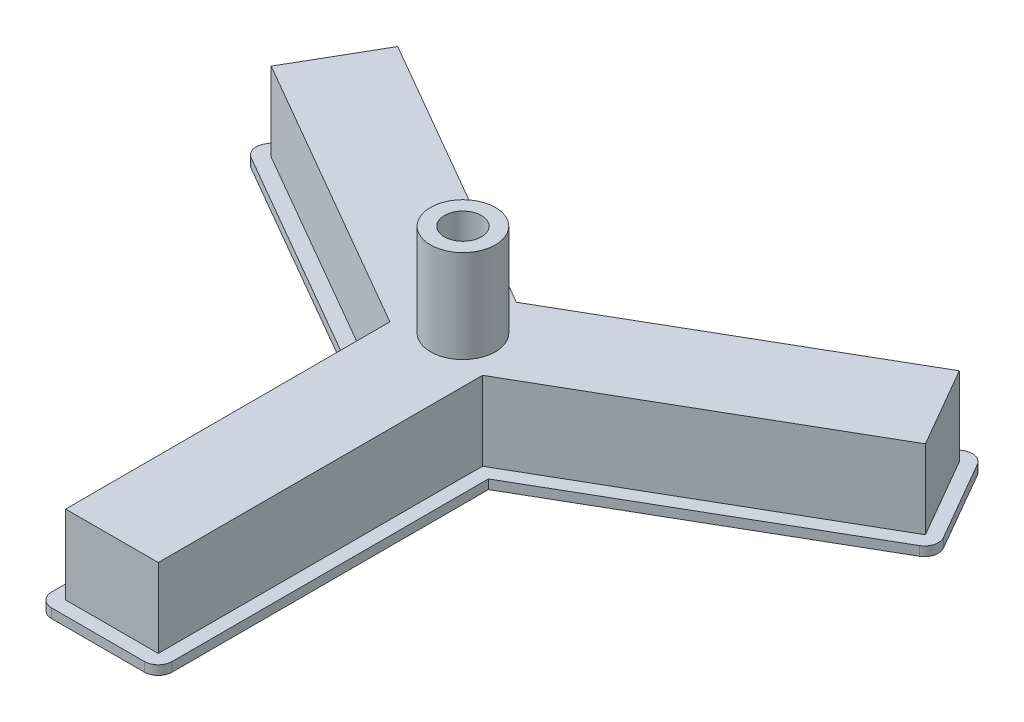
from build123d import *

# Parameters (mm, degrees)
EXTRUDE_1_DEPTH                  = 18
CUT_EXTRUDE_1_DEPTH              = 15
SKETCH_3_R                       = 4
EXTRUDE_5_DEPTH                  = 40
EXTRUDE_6_DEPTH                  = 5
EXTRUDE_7_DEPTH                  = 13.5
PATTERN_LINEAR_1_COUNT           = 8
PATTERN_LINEAR_1_PITCH           = 8.5
PATTERN_CIRCULAR_1_COUNT         = 3
PATTERN_CIRCULAR_1_COPY_1_DEPTH  = 13.5
PATTERN_CIRCULAR_1_COPY_2_DEPTH  = 13.5
PATTERN_CIRCULAR_1_COPY_3_DEPTH  = 13.5
PATTERN_CIRCULAR_1_COPY_4_DEPTH  = 13.5
PATTERN_CIRCULAR_1_COPY_5_DEPTH  = 13.5
PATTERN_CIRCULAR_1_COPY_6_DEPTH  = 13.5
PATTERN_CIRCULAR_1_COPY_7_DEPTH  = 13.5
PATTERN_CIRCULAR_1_COPY_8_DEPTH  = 13.5
PATTERN_CIRCULAR_1_COPY_9_DEPTH  = 13.5
PATTERN_CIRCULAR_1_COPY_10_DEPTH = 13.5
PATTERN_CIRCULAR_1_COPY_11_DEPTH = 13.5
PATTERN_CIRCULAR_1_COPY_12_DEPTH = 13.5
PATTERN_CIRCULAR_1_COPY_13_DEPTH = 13.5
PATTERN_CIRCULAR_1_COPY_14_DEPTH = 13.5
EXTRUDE_8_DEPTH                  = 18
EXTRUDE_9_DEPTH                  = 2
SKETCH_8_R                       = 7
SKETCH_8_R_2                     = 4
EXTRUDE_10_DEPTH                 = 20
EXTRUDE_11_DEPTH                 = 2
FILLET_1_R                       = 3


with BuildPart() as part:
    # 草图1 → 凸台-拉伸1 (new body)
    with BuildSketch(Plane(origin=(0, 0, 0), x_dir=(1, 0, 0), z_dir=(0, 1, 0))):
        Polygon((12.00051402, -78.9285), (-12.00051402, -78.9285), (-12.00051402, -6.9285), (-74.354343093, 29.0715), (-62.353829072, 49.857), (0, 13.857), (62.353829072, 49.857), (74.354343093, 29.0715), (12.00051402, -6.9285), align=None)
    extrude(amount=EXTRUDE_1_DEPTH)

    # 草图2 → 切除-拉伸1 (cut)
    with BuildSketch(Plane(origin=(0, 18, 0), x_dir=(1, 0, 0), z_dir=(0, 1, 0))):
        Polygon((0, 11.5473), (-60.621778265, 46.5473), (-70.62203341, 29.22635), (-10.000255145, -5.77365), (-10.000255145, -75.77365), (10.000255145, -75.77365), (10.000255145, -5.77365), (70.62203341, 29.22635), (60.621778265, 46.5473), align=None)
    extrude(amount=-CUT_EXTRUDE_1_DEPTH, mode=Mode.SUBTRACT)

    # 草图3 → 凸台-拉伸5 (add)
    with BuildSketch(Plane(origin=(0, 3, 0), x_dir=(1, 0, 0), z_dir=(0, 1, 0))):
        with Locations(Location((0, 0, 0), (0, 0, 90))):
            Circle(SKETCH_3_R)
    extrude(amount=EXTRUDE_5_DEPTH)

    # 草图4 → 凸台-拉伸6 (add)
    with BuildSketch(Plane(origin=(0, 3, 0), x_dir=(1, 0, 0), z_dir=(0, 1, 0))):
        Polygon((0, 4), (59.755752861, 38.5), (63.219854476, 32.5), (3.464101615, -2), (3.464101615, -71), (-3.464101615, -71), (-3.464101615, -2), (-63.219854476, 32.5), (-59.941496442, 38.17828268), align=None)
    extrude(amount=EXTRUDE_6_DEPTH)

    # 草图5 → 凸台-拉伸7 (add)
    with BuildSketch(Plane(origin=(0, 3, 0), x_dir=(1, 0, 0), z_dir=(0, 1, 0))):
        Polygon((-3.464101615, -71), (-6.249101615, -71), (-6.249101615, -68), (6.250898385, -68), (6.250898385, -71), align=None)
    extrude_7 = extrude(amount=EXTRUDE_7_DEPTH)

    # 阵列(线性)1: 凸台-拉伸7 ×8
    with Locations(*[(0, 0, -i * PATTERN_LINEAR_1_PITCH) for i in range(1, PATTERN_LINEAR_1_COUNT)]):
        add(extrude_7)

    # 阵列(圆周)1: 凸台-拉伸7 ×3 about axis
    pattern_circular_1_axis = Axis((0, 0, 0), (0, 1, 0))
    for i in range(1, PATTERN_CIRCULAR_1_COUNT):
        add(extrude_7.rotate(pattern_circular_1_axis, i * 360 / PATTERN_CIRCULAR_1_COUNT))

    # 阵列(圆周)1 copy 1 sketch → 阵列(圆周)1 copy 1 (add)
    with BuildSketch(Plane(origin=(-7.361215932, 3, 4.25), x_dir=(-0.4999999999999998, 0, -0.8660254037844387), z_dir=(0, 1, 0))):
        Polygon((-3.464101615, -71), (-6.249101615, -71), (-6.249101615, -68), (6.250898385, -68), (6.250898385, -71), align=None)
    extrude(amount=PATTERN_CIRCULAR_1_COPY_1_DEPTH)

    # 阵列(圆周)1 copy 2 sketch → 阵列(圆周)1 copy 2 (add)
    with BuildSketch(Plane(origin=(7.361215932, 3, 4.25), x_dir=(-0.5000000000000004, 0, 0.8660254037844384), z_dir=(0, 1, 0))):
        Polygon((-3.464101615, -71), (-6.249101615, -71), (-6.249101615, -68), (6.250898385, -68), (6.250898385, -71), align=None)
    extrude(amount=PATTERN_CIRCULAR_1_COPY_2_DEPTH)

    # 阵列(圆周)1 copy 3 sketch → 阵列(圆周)1 copy 3 (add)
    with BuildSketch(Plane(origin=(-14.722431864, 3, 8.5), x_dir=(-0.4999999999999998, 0, -0.8660254037844387), z_dir=(0, 1, 0))):
        Polygon((-3.464101615, -71), (-6.249101615, -71), (-6.249101615, -68), (6.250898385, -68), (6.250898385, -71), align=None)
    extrude(amount=PATTERN_CIRCULAR_1_COPY_3_DEPTH)

    # 阵列(圆周)1 copy 4 sketch → 阵列(圆周)1 copy 4 (add)
    with BuildSketch(Plane(origin=(14.722431864, 3, 8.5), x_dir=(-0.5000000000000004, 0, 0.8660254037844384), z_dir=(0, 1, 0))):
        Polygon((-3.464101615, -71), (-6.249101615, -71), (-6.249101615, -68), (6.250898385, -68), (6.250898385, -71), align=None)
    extrude(amount=PATTERN_CIRCULAR_1_COPY_4_DEPTH)

    # 阵列(圆周)1 copy 5 sketch → 阵列(圆周)1 copy 5 (add)
    with BuildSketch(Plane(origin=(-22.083647797, 3, 12.75), x_dir=(-0.4999999999999998, 0, -0.8660254037844387), z_dir=(0, 1, 0))):
        Polygon((-3.464101615, -71), (-6.249101615, -71), (-6.249101615, -68), (6.250898385, -68), (6.250898385, -71), align=None)
    extrude(amount=PATTERN_CIRCULAR_1_COPY_5_DEPTH)

    # 阵列(圆周)1 copy 6 sketch → 阵列(圆周)1 copy 6 (add)
    with BuildSketch(Plane(origin=(22.083647797, 3, 12.75), x_dir=(-0.5000000000000004, 0, 0.8660254037844384), z_dir=(0, 1, 0))):
        Polygon((-3.464101615, -71), (-6.249101615, -71), (-6.249101615, -68), (6.250898385, -68), (6.250898385, -71), align=None)
    extrude(amount=PATTERN_CIRCULAR_1_COPY_6_DEPTH)

    # 阵列(圆周)1 copy 7 sketch → 阵列(圆周)1 copy 7 (add)
    with BuildSketch(Plane(origin=(-29.444863729, 3, 17), x_dir=(-0.4999999999999998, 0, -0.8660254037844387), z_dir=(0, 1, 0))):
        Polygon((-3.464101615, -71), (-6.249101615, -71), (-6.249101615, -68), (6.250898385, -68), (6.250898385, -71), align=None)
    extrude(amount=PATTERN_CIRCULAR_1_COPY_7_DEPTH)

    # 阵列(圆周)1 copy 8 sketch → 阵列(圆周)1 copy 8 (add)
    with BuildSketch(Plane(origin=(29.444863729, 3, 17), x_dir=(-0.5000000000000004, 0, 0.8660254037844384), z_dir=(0, 1, 0))):
        Polygon((-3.464101615, -71), (-6.249101615, -71), (-6.249101615, -68), (6.250898385, -68), (6.250898385, -71), align=None)
    extrude(amount=PATTERN_CIRCULAR_1_COPY_8_DEPTH)

    # 阵列(圆周)1 copy 9 sketch → 阵列(圆周)1 copy 9 (add)
    with BuildSketch(Plane(origin=(-36.806079661, 3, 21.25), x_dir=(-0.4999999999999998, 0, -0.8660254037844387), z_dir=(0, 1, 0))):
        Polygon((-3.464101615, -71), (-6.249101615, -71), (-6.249101615, -68), (6.250898385, -68), (6.250898385, -71), align=None)
    extrude(amount=PATTERN_CIRCULAR_1_COPY_9_DEPTH)

    # 阵列(圆周)1 copy 10 sketch → 阵列(圆周)1 copy 10 (add)
    with BuildSketch(Plane(origin=(36.806079661, 3, 21.25), x_dir=(-0.5000000000000004, 0, 0.8660254037844384), z_dir=(0, 1, 0))):
        Polygon((-3.464101615, -71), (-6.249101615, -71), (-6.249101615, -68), (6.250898385, -68), (6.250898385, -71), align=None)
    extrude(amount=PATTERN_CIRCULAR_1_COPY_10_DEPTH)

    # 阵列(圆周)1 copy 11 sketch → 阵列(圆周)1 copy 11 (add)
    with BuildSketch(Plane(origin=(-44.167295593, 3, 25.5), x_dir=(-0.4999999999999998, 0, -0.8660254037844387), z_dir=(0, 1, 0))):
        Polygon((-3.464101615, -71), (-6.249101615, -71), (-6.249101615, -68), (6.250898385, -68), (6.250898385, -71), align=None)
    extrude(amount=PATTERN_CIRCULAR_1_COPY_11_DEPTH)

    # 阵列(圆周)1 copy 12 sketch → 阵列(圆周)1 copy 12 (add)
    with BuildSketch(Plane(origin=(44.167295593, 3, 25.5), x_dir=(-0.5000000000000004, 0, 0.8660254037844384), z_dir=(0, 1, 0))):
        Polygon((-3.464101615, -71), (-6.249101615, -71), (-6.249101615, -68), (6.250898385, -68), (6.250898385, -71), align=None)
    extrude(amount=PATTERN_CIRCULAR_1_COPY_12_DEPTH)

    # 阵列(圆周)1 copy 13 sketch → 阵列(圆周)1 copy 13 (add)
    with BuildSketch(Plane(origin=(-51.528511525, 3, 29.75), x_dir=(-0.4999999999999998, 0, -0.8660254037844387), z_dir=(0, 1, 0))):
        Polygon((-3.464101615, -71), (-6.249101615, -71), (-6.249101615, -68), (6.250898385, -68), (6.250898385, -71), align=None)
    extrude(amount=PATTERN_CIRCULAR_1_COPY_13_DEPTH)

    # 阵列(圆周)1 copy 14 sketch → 阵列(圆周)1 copy 14 (add)
    with BuildSketch(Plane(origin=(51.528511525, 3, 29.75), x_dir=(-0.5000000000000004, 0, 0.8660254037844384), z_dir=(0, 1, 0))):
        Polygon((-3.464101615, -71), (-6.249101615, -71), (-6.249101615, -68), (6.250898385, -68), (6.250898385, -71), align=None)
    extrude(amount=PATTERN_CIRCULAR_1_COPY_14_DEPTH)


with BuildPart() as body_2:
    # 草图6 → 凸台-拉伸8 (new body)
    with BuildSketch(Plane.XZ):
        Polygon((-12.00051402, 78.9285), (12.00051402, 78.9285), (12.00051402, 6.9285), (74.354343093, -29.0715), (62.353829072, -49.857), (0, -13.857), (-62.353829072, -49.857), (-74.354343093, -29.0715), (-12.00051402, 6.9285), align=None)
    extrude(amount=-EXTRUDE_8_DEPTH)

    # 相交1: read off the stored shape, not the designer's step
    # 相交1: cut part
    add(part.part, mode=Mode.SUBTRACT)

    # 草图7 → 凸台-拉伸9 (add)
    with BuildSketch(Plane(origin=(0, 3, 0), x_dir=(-1, 0, 0), z_dir=(0, -1, 0))):
        Polygon((10.000255145, -75.77365), (-10.000255145, -75.77365), (-10.000255145, -5.77365), (-70.62203341, 29.22635), (-60.621778265, 46.5473), (0, 11.5473), (60.621778265, 46.5473), (70.62203341, 29.22635), (10.000255145, -5.77365), align=None)
    extrude(amount=EXTRUDE_9_DEPTH)

    # 草图8 → 凸台-拉伸10 (add)
    with BuildSketch(Plane(origin=(0, 18, 0), x_dir=(1, 0, 0), z_dir=(0, 1, 0))):
        with Locations(Location((0, 0, 0), (0, 0, 270))):
            Circle(SKETCH_8_R)
        with Locations(Location((0, 0, 0), (0, 0, 90))):
            Circle(SKETCH_8_R_2, mode=Mode.SUBTRACT)
    extrude(amount=EXTRUDE_10_DEPTH)

    # 草图9 → 凸台-拉伸11 (add)
    with BuildSketch(Plane.XZ.offset(-1)):
        Polygon((-10.000255145, 78.77365), (13.000255145, 78.77365), (13.000255145, 7.505700808), (74.584862856, -28.050189032), (61.584862856, -50.566849531), (0, -15.010812383), (-62.237844795, -50.943848829), (-75.237844795, -28.427188331), (-13.000255145, 7.505700808), (-13.000255145, 78.77365), align=None)
    extrude(amount=EXTRUDE_11_DEPTH)

    # 圆角1
    fillet_1_edges = [body_2.edges().sort_by_distance(p)[0] for p in [
        (-13.000255145, 0, 78.77365),
        (-75.237844795, 0, -28.427188331),
        (-62.237844795, 0, -50.943848829),
        (61.584862856, 0, -50.566849531),
        (74.584862856, 0, -28.050189032),
        (13.000255145, 0, 78.77365),
    ]]
    fillet(fillet_1_edges, radius=FILLET_1_R)


solid = body_2.part
